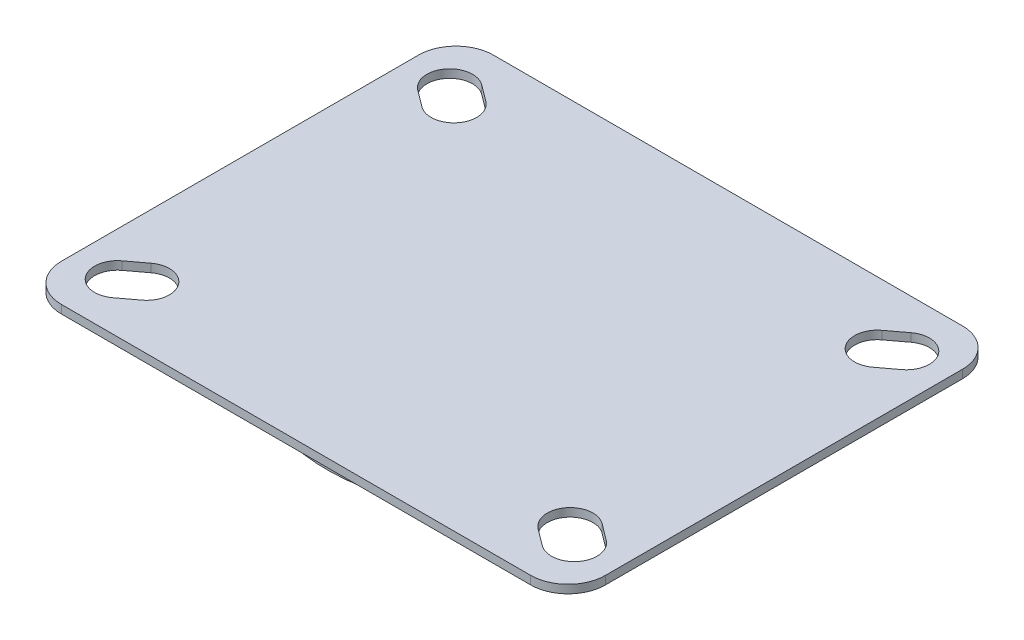
from build123d import *

# Parameters (mm, degrees)
BRIDA_BASE1_DEPTH     = 2
CROQUIS6_R            = 44.5
CROQUIS6_R_2          = 42.5
EXTRUIR_L_MINA1_DEPTH = 8


# Sheet-metal steps are written as plain solids
with BuildPart() as part:
    # Croquis1 → Brida base1 (new body)
    with BuildSketch(Plane(origin=(0, 0, 0), x_dir=(1, 0, 0), z_dir=(0, 1, 0))):
        with BuildLine():
            Line((-56.495613698, -52), (56.495613698, -52))
            ThreePointArc((56.495613698, -52), (62.862676312, -49.362676312), (65.5, -42.995613698))
            Line((65.5, -42.995613698), (65.5, 42.995613698))
            ThreePointArc((65.5, 42.995613698), (62.862676312, 49.362676312), (56.495613698, 52))
            Line((56.495613698, 52), (-56.495613698, 52))
            ThreePointArc((-56.495613698, 52), (-62.862676312, 49.362676312), (-65.5, 42.995613698))
            Line((-65.5, 42.995613698), (-65.5, -42.995613698))
            ThreePointArc((-65.5, -42.995613698), (-62.862676312, -49.362676312), (-56.495613698, -52))
        make_face()
        with BuildLine():
            Line((-51.690195136, 44.4), (-47.690195136, 41.4))
            ThreePointArc((-47.690195136, 41.4), (-46.590195136, 33.7), (-54.290195136, 32.6))
            Line((-54.290195136, 32.6), (-58.290195136, 35.6))
            ThreePointArc((-58.290195136, 35.6), (-59.390195136, 43.3), (-51.690195136, 44.4))
        make_face(mode=Mode.SUBTRACT)
        with BuildLine():
            Line((51.690195136, 44.4), (47.690195136, 41.4))
            ThreePointArc((47.690195136, 41.4), (46.590195136, 33.7), (54.290195136, 32.6))
            Line((54.290195136, 32.6), (58.290195136, 35.6))
            ThreePointArc((58.290195136, 35.6), (59.390195136, 43.3), (51.690195136, 44.4))
        make_face(mode=Mode.SUBTRACT)
        with BuildLine():
            Line((-51.690195136, -44.4), (-47.690195136, -41.4))
            ThreePointArc((-47.690195136, -41.4), (-46.590195136, -33.7), (-54.290195136, -32.6))
            Line((-54.290195136, -32.6), (-58.290195136, -35.6))
            ThreePointArc((-58.290195136, -35.6), (-59.390195136, -43.3), (-51.690195136, -44.4))
        make_face(mode=Mode.SUBTRACT)
        with BuildLine():
            Line((51.690195136, -44.4), (47.690195136, -41.4))
            ThreePointArc((47.690195136, -41.4), (46.590195136, -33.7), (54.290195136, -32.6))
            Line((54.290195136, -32.6), (58.290195136, -35.6))
            ThreePointArc((58.290195136, -35.6), (59.390195136, -43.3), (51.690195136, -44.4))
        make_face(mode=Mode.SUBTRACT)
    extrude(amount=-BRIDA_BASE1_DEPTH)


with BuildPart() as body_2:
    # Croquis6 → Extruir-Lámina1 (new body)
    with BuildSketch(Plane(origin=(0, -2, 0), x_dir=(1, 0, 0), z_dir=(0, 1, 0))):
        Circle(CROQUIS6_R)
        Circle(CROQUIS6_R_2, mode=Mode.SUBTRACT)
    extrude(amount=-EXTRUIR_L_MINA1_DEPTH)


solid = Compound([part.part, body_2.part])
